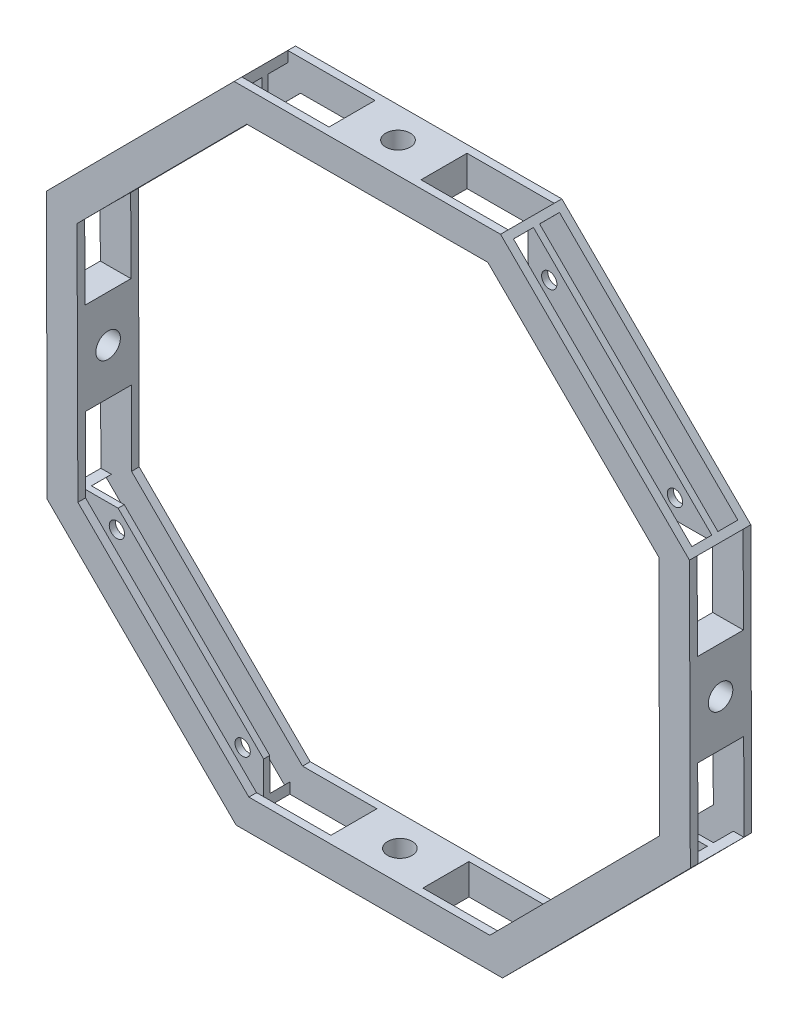
from build123d import *

# Parameters (mm, degrees)
RESSALTO_EXTRUS_O1_DEPTH   = 40
CORTE_EXTRUS_O2_DEPTH      = 472.325034981
CORTE_EXTRUS_O2_DEPTH_BACK = 472.325034981
ESBO_O2_W                  = 30
ESBO_O2_H                  = 56.886475485
CORTE_EXTRUS_O3_DEPTH      = 472.325034981
CORTE_EXTRUS_O3_DEPTH_BACK = 472.325034981
ESBO_O4_R                  = 8
CORTE_EXTRUS_O4_DEPTH      = 472.325034981
CORTE_EXTRUS_O4_DEPTH_BACK = 472.325034981
ESBO_O2_4_W                = 30
ESBO_O2_4_H                = 56.8738489
CORTE_EXTRUS_O5_DEPTH      = 509.292623965
CORTE_EXTRUS_O5_DEPTH_BACK = 509.292623965
ESBO_O15_W                 = 13
ESBO_O15_H                 = 164
CORTE_EXTRUS_O6_DEPTH      = 509.292623965
CORTE_EXTRUS_O6_DEPTH_BACK = 509.292623965
ESBO_O16_W                 = 13
ESBO_O16_H                 = 164
CORTE_EXTRUS_O8_DEPTH      = 472.325034981
CORTE_EXTRUS_O8_DEPTH_BACK = 472.325034981
ESBO_O22_W                 = 56.8738489
ESBO_O22_H                 = 30
CORTE_EXTRUS_O9_DEPTH      = 472.325034981
CORTE_EXTRUS_O9_DEPTH_BACK = 472.325034981
ESBO_O23_R                 = 8
ESBO_O26_R                 = 5
CORTE_EXTRUS_O10_DEPTH     = 10


with BuildPart() as part:
    # Esboço1 → Ressalto-extrusão1 (new body)
    with BuildSketch(Plane.XY):
        Polygon((209.462037834, 87.522810264), (86.224054708, 210), (-87.522810264, 209.462037834), (-210, 86.224054708), (-209.462037834, -87.522810264), (-86.224054708, -210), (87.522810264, -209.462037834), (210, -86.224054708), align=None)
        Polygon((189.450398417, 79.250178434), (77.923322838, 190), (-79.250178434, 189.450398417), (-190, 77.923322838), (-189.450398417, -79.250178434), (-77.923322838, -190), (79.250178434, -189.450398417), (190, -77.923322838), align=None, mode=Mode.SUBTRACT)
    extrude(amount=RESSALTO_EXTRUS_O1_DEPTH)

    # Esboço2 → Corte-extrusão2 (cut, two sides: drawn at the far end of the back side and taken through both)
    with BuildSketch(Plane(origin=(209.731018917, 0.649377778, 0), x_dir=(0, 0, -1), z_dir=(0.9999952066803229, 0.003096226150999412, 0)).offset(-CORTE_EXTRUS_O2_DEPTH_BACK)):
        with Locations((-20, 58.430611157)):
            Rectangle(ESBO_O2_W, ESBO_O2_H)
    extrude(amount=CORTE_EXTRUS_O2_DEPTH + CORTE_EXTRUS_O2_DEPTH_BACK, mode=Mode.SUBTRACT)

    # Esboço4 → Corte-extrusão3 (cut, two sides: drawn at the far end of the back side and taken through both)
    with BuildSketch(Plane(origin=(209.731018917, 0.649377778, 0), x_dir=(0, 0, -1), z_dir=(0.9999952066803229, 0.003096226150999412, 0)).offset(-CORTE_EXTRUS_O3_DEPTH_BACK)):
        with Locations((-20, 0)):
            Circle(ESBO_O4_R)
    extrude(amount=CORTE_EXTRUS_O3_DEPTH + CORTE_EXTRUS_O3_DEPTH_BACK, mode=Mode.SUBTRACT)

    # Esboço2<4> → Corte-extrusão4 (cut, two sides: drawn at the far end of the back side and taken through both)
    with BuildSketch(Plane(origin=(209.731018917, 0.649377778, 0), x_dir=(0, 0, -1), z_dir=(0.9999952066803229, 0.003096226150999412, 0)).offset(-CORTE_EXTRUS_O4_DEPTH_BACK)):
        with Locations((-20, -58.43692445)):
            Rectangle(ESBO_O2_4_W, ESBO_O2_4_H)
    extrude(amount=CORTE_EXTRUS_O4_DEPTH + CORTE_EXTRUS_O4_DEPTH_BACK, mode=Mode.SUBTRACT)

    # Esboço15 → Corte-extrusão5 (cut, two sides: drawn at the far end of the back side and taken through both)
    with BuildSketch(Plane(origin=(-148.761405132, 147.843046271, 0), x_dir=(0, 0, 1), z_dir=(-0.7092927543051587, 0.7049140292902405, 0)).offset(-CORTE_EXTRUS_O5_DEPTH_BACK)):
        with Locations((11.5, 0)):
            Rectangle(ESBO_O15_W, ESBO_O15_H)
        with Locations((28.5, 0)):
            Rectangle(ESBO_O15_W, ESBO_O15_H)
    extrude(amount=CORTE_EXTRUS_O5_DEPTH + CORTE_EXTRUS_O5_DEPTH_BACK, mode=Mode.SUBTRACT)

    # Esboço16 → Corte-extrusão6 (cut, two sides: drawn at the far end of the back side and taken through both)
    with BuildSketch(Plane(origin=(147.843046271, 148.761405132, 0), x_dir=(0, 0, -1), z_dir=(0.7049140292902406, 0.7092927543051585, 0)).offset(-CORTE_EXTRUS_O6_DEPTH_BACK)):
        with Locations((-28.5, 0)):
            Rectangle(ESBO_O16_W, ESBO_O16_H)
        with Locations((-11.5, 0)):
            Rectangle(ESBO_O16_W, ESBO_O16_H)
    extrude(amount=CORTE_EXTRUS_O6_DEPTH + CORTE_EXTRUS_O6_DEPTH_BACK, mode=Mode.SUBTRACT)

    # Esboço22 → Corte-extrusão8 (cut, two sides: drawn at the far end of the back side and taken through both)
    with BuildSketch(Plane(origin=(-0.649377778, 209.731018917, 0), x_dir=(0.9999952066803229, 0.0030962261509995728, 0), z_dir=(-0.0030962261509995728, 0.9999952066803229, 0)).offset(-CORTE_EXTRUS_O8_DEPTH_BACK)):
        with Locations((-58.43692445, -20)):
            Rectangle(ESBO_O22_W, ESBO_O22_H)
        with Locations((58.43692445, -20)):
            Rectangle(ESBO_O22_W, ESBO_O22_H)
    extrude(amount=CORTE_EXTRUS_O8_DEPTH + CORTE_EXTRUS_O8_DEPTH_BACK, mode=Mode.SUBTRACT)

    # Esboço23 → Corte-extrusão9 (cut, two sides: drawn at the far end of the back side and taken through both)
    with BuildSketch(Plane(origin=(-0.649377778, 209.731018917, 0), x_dir=(0.9999952066803229, 0.0030962261509995728, 0), z_dir=(-0.0030962261509995728, 0.9999952066803229, 0)).offset(-CORTE_EXTRUS_O9_DEPTH_BACK)):
        with Locations((0, -20)):
            Circle(ESBO_O23_R)
    extrude(amount=CORTE_EXTRUS_O9_DEPTH + CORTE_EXTRUS_O9_DEPTH_BACK, mode=Mode.SUBTRACT)

    # Esboço26 → Corte-extrusão10 (cut)
    with BuildSketch(Plane(origin=(0, 0, 18), x_dir=(-1, 0, 0), z_dir=(0, 0, -1))):
        with Locations((100, 182)):
            Circle(ESBO_O26_R)
        with Locations((182, 100)):
            Circle(ESBO_O26_R)
        with Locations((-182, -100)):
            Circle(ESBO_O26_R)
        with Locations((-100, -182)):
            Circle(ESBO_O26_R)
        with Locations((100, -182)):
            Circle(ESBO_O26_R)
        with Locations((182, -100)):
            Circle(ESBO_O26_R)
        with Locations((-182, 100)):
            Circle(ESBO_O26_R)
        with Locations((-100, 182)):
            Circle(ESBO_O26_R)
    extrude(amount=-CORTE_EXTRUS_O10_DEPTH, mode=Mode.SUBTRACT)


solid = part.part
